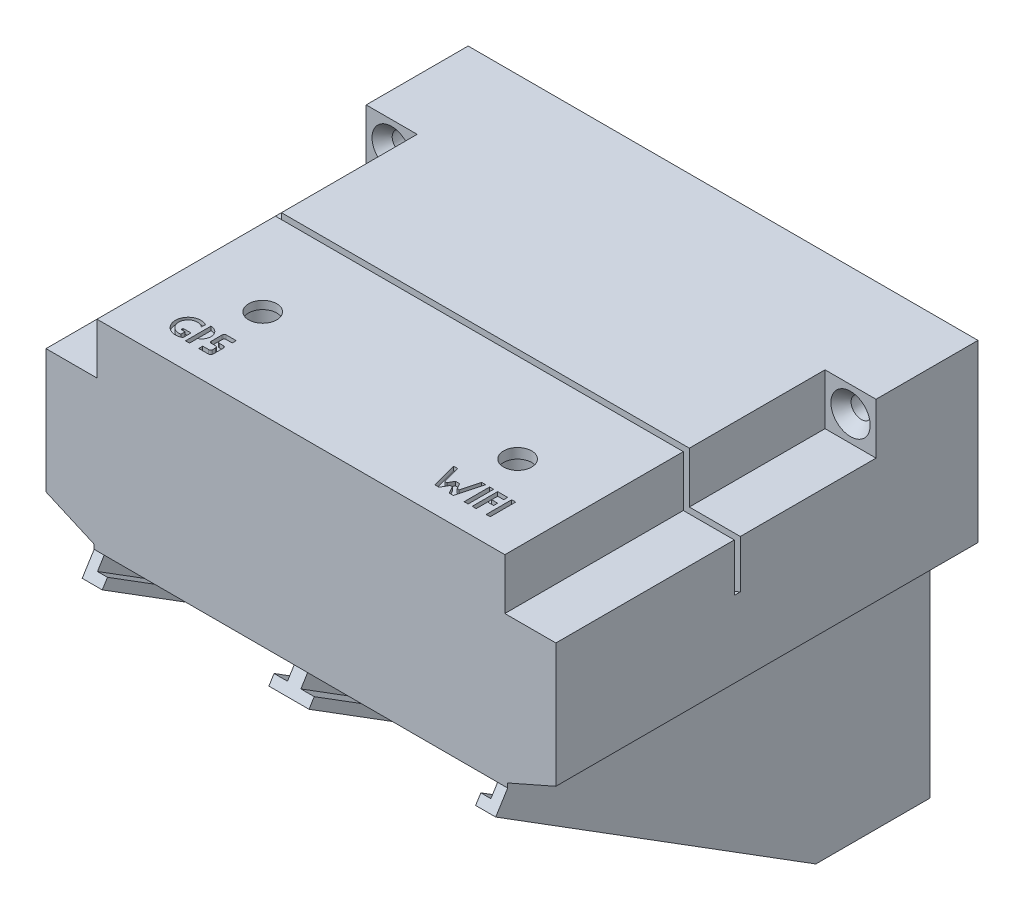
from build123d import *

# Parameters (mm, degrees)
BOSS_EXTRU_1_DEPTH                                = 59.2
BOSS_EXTRU_2_DEPTH                                = 1.5
BOSS_EXTRU_3_DEPTH                                = 44.45
ESQUISSE5_W                                       = 98
ESQUISSE5_H                                       = 50
ENL_V_MAT_EXTRU_1_DEPTH                           = 79.75
NERVURE3_REACH                                    = 219.919
ESQUISSE7_WALL_W                                  = 531.966109146
ESQUISSE7_WALL_H                                  = 10
ESQUISSE8_W                                       = 12.7
ESQUISSE8_H                                       = 12.7
ENL_V_MAT_EXTRU_2_DEPTH                           = 79.75
FRAISAGE_POUR_VIS_T_TE_FRAIS_E_BOMB_E_D           = 5.1054
FRAISAGE_POUR_VIS_T_TE_FRAIS_E_BOMB_E_CSINK_D     = 9.779
FRAISAGE_POUR_VIS_T_TE_FRAIS_E_BOMB_E_CSINK_ANGLE = 82
ENL_VEMENT_START                                  = 1.582341914
ENL_VEMENT_DE_MATI_RE_BALAYAGE2_OUTLINE_R         = 6.35
ENL_VEMENT_DE_MATI_RE_BALAYAGE2_DEPTH             = 71.529963189
ENL_VEMENT_START_2                                = -14.345570266
ENL_VEMENT_DE_MATI_RE_BALAYAGE3_OUTLINE_R         = 6.35
ENL_VEMENT_DE_MATI_RE_BALAYAGE3_DEPTH             = 71.529963189
ESQUISSE26_R                                      = 6.35
ENL_V_MAT_EXTRU_4_DEPTH                           = 3.175
ENL_V_MAT_EXTRU_5_REACH                           = 258.559
ESQUISSE27_R                                      = 3.5
ESQUISSE35_W                                      = 1
ESQUISSE35_H                                      = 6.35
LETTRE_I_WIFI_2_DEPTH                             = 1
LETTRE_F_DEPTH                                    = 1
ESQUISSE38_W                                      = 1
ESQUISSE38_H                                      = 6.35
LETTRE_I_WIFI_1_DEPTH                             = 1
LETTRE_W_DEPTH                                    = 1
LETTRE_G_DEPTH                                    = 1
LETTRE_P_DEPTH                                    = 1
LETTRE_S_DEPTH                                    = 1
ESQUISSE28_R                                      = 5.55625
TROU_FIL_GPS_DEPTH                                = 48
ESQUISSE28_4_R                                    = 5.55625
TROU_FIL_WIFI_DEPTH                               = 47.5
NERVURE9_REACH                                    = 258.559
ESQUISSE44_WALL_W                                 = 609.246066174
ESQUISSE44_WALL_H                                 = 2.5
BOSS_EXTRU_4_REACH                                = 258.559
BOSS_EXTRU_5_DEPTH                                = 2.5
BOSS_EXTRU_8_REACH                                = 249.303
ESQUISSE51_W                                      = 2.5
ESQUISSE51_H                                      = 105.15
BOSS_EXTRU_7_DEPTH                                = 94.127905
ESQUISSE52_W                                      = 2.5
ESQUISSE52_H                                      = 2.446117838
BOSS_EXTRU_9_DEPTH                                = 94.127905
ENL_V_MAT_EXTRU_7_REACH                           = 263.075
ENL_V_MAT_EXTRU_8_REACH                           = 258.559


# Read off the part's stored shape, not the designer's step: Enlèvement de matière-Balayage2, Enlèvement de matière-Balayage3
with BuildPart() as part:
    # Esquisse2 → Boss.-Extru.1 (new body)
    with BuildSketch(Plane.XY):
        Polygon((0, 0), (98, 0), (98, 50), (211.579865137, 100), (-113.579865137, 100), (0, 50), align=None)
    extrude(amount=BOSS_EXTRU_1_DEPTH)

    # Esquisse3 → Boss.-Extru.2 (add)
    with BuildSketch(Plane.XY.offset(59.2)):
        Polygon((0, 0), (98, 0), (98, 50), (211.579865137, 100), (168.51775825, 100), (92.873568069, 66.7), (5.126431931, 66.7), (-70.51775825, 100), (-113.579865137, 100), (0, 50), align=None)
    extrude(amount=BOSS_EXTRU_2_DEPTH)

    # Esquisse4 → Boss.-Extru.3 (add)
    with BuildSketch(Plane.XY.offset(60.7)):
        Polygon((0, 0), (98, 0), (98, 50), (211.579865137, 100), (-113.579865137, 100), (0, 50), align=None)
    extrude(amount=BOSS_EXTRU_3_DEPTH)

    # Esquisse5 → Enlèv. mat.-Extru.1 (cut)
    with BuildSketch(Plane.XY.offset(105.15)):
        with Locations((49, 25)):
            Rectangle(ESQUISSE5_W, ESQUISSE5_H)
    extrude(amount=-ENL_V_MAT_EXTRU_1_DEPTH, mode=Mode.SUBTRACT)

    # Esquisse7 wall → Nervure3 (add, up to next)
    with BuildSketch(Plane(origin=(49, 25, 65.275), x_dir=(0, -0.531192105031, -0.847251407525), z_dir=(0, 0.847251407525, -0.531192105031)), mode=Mode.PRIVATE) as nervure3_sk1:
        Rectangle(ESQUISSE7_WALL_W, ESQUISSE7_WALL_H)
    nervure3_tool1 = extrude(nervure3_sk1.sketch, amount=NERVURE3_REACH, mode=Mode.PRIVATE) - part.part
    add(nervure3_tool1.solids().sort_by_distance((49, 25, 65.275))[0])

    # Esquisse8 → Enlèv. mat.-Extru.2 (cut)
    with BuildSketch(Plane.XY.offset(105.15)):
        with Locations((-8.15, 93.65)):
            Rectangle(ESQUISSE8_W, ESQUISSE8_H)
    enl_v_mat_extru_2 = extrude(amount=-ENL_V_MAT_EXTRU_2_DEPTH, mode=Mode.SUBTRACT)

    # Symétrie1: Enlèv. mat.-Extru.2 across plane
    add(enl_v_mat_extru_2.mirror(Plane(origin=(49, 0, 0), x_dir=(0, 0, 1), z_dir=(1, 0, 0))), mode=Mode.SUBTRACT)

    # Fraisage pour vis à tête fraisée bombée #101 (through all)
    with Locations(Plane.XY.offset(25.4)):
        with Locations((22, 25), (76, 25), (106.15, 93.65), (-8.15, 93.65)):
            CounterSinkHole(FRAISAGE_POUR_VIS_T_TE_FRAIS_E_BOMB_E_D / 2, FRAISAGE_POUR_VIS_T_TE_FRAIS_E_BOMB_E_CSINK_D / 2, counter_sink_angle=FRAISAGE_POUR_VIS_T_TE_FRAIS_E_BOMB_E_CSINK_ANGLE)

    # Enlèvement de matière-Balayage2 outline → Enlèvement de matière-Balayage2 (cut)
    with BuildSketch(Plane(origin=(0, 0, 0), x_dir=(0.8002544678430299, -0.3970882953901229, 0.44934805258444765), z_dir=(0.5996605595645498, 0.5299192642332058, -0.5996605595645498)).offset(ENL_VEMENT_START)):
        with Locations((6.44062437, -61.833135415)):
            Circle(ENL_VEMENT_DE_MATI_RE_BALAYAGE2_OUTLINE_R)
    extrude(amount=ENL_VEMENT_DE_MATI_RE_BALAYAGE2_DEPTH, mode=Mode.SUBTRACT)

    # Enlèvement de matière-Balayage3 outline → Enlèvement de matière-Balayage3 (cut)
    with BuildSketch(Plane(origin=(0, 0, 0), x_dir=(0.8002544678430281, 0.39708829539012125, -0.4493480525844523), z_dir=(0.5996605595645522, -0.5299192642332002, 0.5996605595645522)).offset(ENL_VEMENT_START_2)):
        with Locations((71.984313478, 61.833135415)):
            Circle(ENL_VEMENT_DE_MATI_RE_BALAYAGE3_OUTLINE_R)
    extrude(amount=ENL_VEMENT_DE_MATI_RE_BALAYAGE3_DEPTH, mode=Mode.SUBTRACT)

    # Esquisse26 → Enlèv. mat.-Extru.4 (cut)
    with BuildSketch(Plane(origin=(0, 0, 0), x_dir=(-1, 0, 0), z_dir=(0, 0, -1))):
        with Locations((-49, 82.52)):
            Circle(ESQUISSE26_R)
    extrude(amount=-ENL_V_MAT_EXTRU_4_DEPTH, mode=Mode.SUBTRACT)

    # Esquisse27 → Enlèv. mat.-Extru.5 (cut, up to next)
    with BuildSketch(Plane(origin=(0, 100, 0), x_dir=(1, 0, 0), z_dir=(0, 1, 0)), mode=Mode.PRIVATE) as enl_v_mat_extru_5_sk1:
        with Locations(Location((17.25, -82.925, 0), (0, 0, 180))):
            Circle(ESQUISSE27_R)
    enl_v_mat_extru_5_tool1 = extrude(enl_v_mat_extru_5_sk1.sketch, amount=-ENL_V_MAT_EXTRU_5_REACH, mode=Mode.PRIVATE) & part.part
    # Esquisse27 → Enlèv. mat.-Extru.5 (cut, up to next)
    with BuildSketch(Plane(origin=(0, 100, 0), x_dir=(1, 0, 0), z_dir=(0, 1, 0)), mode=Mode.PRIVATE) as enl_v_mat_extru_5_sk2:
        with Locations(Location((80.75, -82.925, 0), (0, 0, 180))):
            Circle(ESQUISSE27_R)
    enl_v_mat_extru_5_tool2 = extrude(enl_v_mat_extru_5_sk2.sketch, amount=-ENL_V_MAT_EXTRU_5_REACH, mode=Mode.PRIVATE) & part.part
    add(enl_v_mat_extru_5_tool1.solids().sort_by_distance((17.25, 100, 82.925))[0], mode=Mode.SUBTRACT)
    add(enl_v_mat_extru_5_tool2.solids().sort_by_distance((80.75, 100, 82.925))[0], mode=Mode.SUBTRACT)

    # Esquisse35 → Lettre_i(wifi)_2 (cut)
    with BuildSketch(Plane(origin=(0, 100, 0), x_dir=(1, 0, 0), z_dir=(0, 1, 0))):
        with Locations((89.3, -95.625)):
            Rectangle(ESQUISSE35_W, ESQUISSE35_H)
    extrude(amount=-LETTRE_I_WIFI_2_DEPTH, mode=Mode.SUBTRACT)

    # Esquisse36 → Lettre_F (cut)
    with BuildSketch(Plane(origin=(0, 100, 0), x_dir=(1, 0, 0), z_dir=(0, 1, 0))):
        Polygon((85.3, -98.8), (86.3, -98.8), (86.3, -95.95), (87.8, -95.95), (87.8, -94.95), (86.3, -94.95), (86.3, -93.45), (87.8, -93.45), (87.8, -92.45), (85.3, -92.45), align=None)
    extrude(amount=-LETTRE_F_DEPTH, mode=Mode.SUBTRACT)

    # Esquisse38 → Lettre_i(wifi)_1 (cut)
    with BuildSketch(Plane(origin=(0, 100, 0), x_dir=(1, 0, 0), z_dir=(0, 1, 0))):
        with Locations((83.8, -95.625)):
            Rectangle(ESQUISSE38_W, ESQUISSE38_H)
    extrude(amount=-LETTRE_I_WIFI_1_DEPTH, mode=Mode.SUBTRACT)

    # Esquisse39 → Lettre_W (cut)
    with BuildSketch(Plane(origin=(0, 100, 0), x_dir=(1, 0, 0), z_dir=(0, 1, 0))):
        Polygon((74.3625, -92.45), (76.063977372, -98.8), (77.063977372, -98.8), (78.08125, -97.038032123), (78.58125, -97.038032123), (79.598522628, -98.8), (80.598522628, -98.8), (82.3, -92.45), (81.3, -92.45), (80.123041681, -96.842468245), (79.623041681, -96.842468245), (78.83125, -95.471044825), (77.83125, -95.471044825), (77.039458319, -96.842468245), (76.539458319, -96.842468245), (75.3625, -92.45), align=None)
    extrude(amount=-LETTRE_W_DEPTH, mode=Mode.SUBTRACT)

    # Esquisse40 → Lettre_G (cut)
    with BuildSketch(Plane(origin=(0, 100, 0), x_dir=(1, 0, 0), z_dir=(0, 1, 0))):
        with BuildLine():
            Line((11.894022551, -97.913045102), (11.894022551, -96.913045102))
            Line((11.894022551, -96.913045102), (10.894022551, -96.913045102))
            Line((10.894022551, -96.913045102), (10.894022551, -96.413045102))
            Line((10.894022551, -96.413045102), (12.894022551, -96.413045102))
            Line((12.894022551, -96.413045102), (12.894022551, -98.413045102))
            ThreePointArc((12.894022551, -98.413045102), (8.2, -95.625), (12.894022551, -92.836954898))
            Line((12.894022551, -92.836954898), (12.894022551, -93.836954898))
            ThreePointArc((12.894022551, -93.836954898), (9.096396306, -95.065983006), (11.894022551, -97.913045102))
        make_face()
    extrude(amount=-LETTRE_G_DEPTH, mode=Mode.SUBTRACT)

    # Esquisse41 → Lettre_P (cut)
    with BuildSketch(Plane(origin=(0, 100, 0), x_dir=(1, 0, 0), z_dir=(0, 1, 0))):
        with BuildLine():
            Line((14.894022551, -98.8), (13.894022551, -98.8))
            Line((13.894022551, -98.8), (13.894022551, -92.45))
            ThreePointArc((13.894022551, -92.45), (16.125753942, -94.22690083), (14.894022551, -96.8))
            Line((14.894022551, -96.8), (14.894022551, -98.8))
        make_face()
    extrude(amount=-LETTRE_P_DEPTH, mode=Mode.SUBTRACT)

    # Esquisse42 → Lettre_S (cut)
    with BuildSketch(Plane(origin=(0, 100, 0), x_dir=(1, 0, 0), z_dir=(0, 1, 0))):
        with BuildLine():
            Line((20.18396508, -93.45), (18.68396508, -93.45))
            ThreePointArc((18.68396508, -93.45), (18.330411689, -93.596446609), (18.18396508, -93.95))
            Line((18.18396508, -93.95), (18.18396508, -94.625))
            ThreePointArc((18.18396508, -94.625), (18.330411689, -94.978553391), (18.68396508, -95.125))
            Line((18.68396508, -95.125), (19.68396508, -95.125))
            ThreePointArc((19.68396508, -95.125), (20.03751847, -95.271446609), (20.18396508, -95.625))
            Line((20.18396508, -95.625), (20.18396508, -98.3))
            ThreePointArc((20.18396508, -98.3), (20.03751847, -98.653553391), (19.68396508, -98.8))
            Line((19.68396508, -98.8), (17.18396508, -98.8))
            Line((17.18396508, -98.8), (17.18396508, -97.8))
            Line((17.18396508, -97.8), (18.68396508, -97.8))
            ThreePointArc((18.68396508, -97.8), (19.03751847, -97.653553391), (19.18396508, -97.3))
            Line((19.18396508, -97.3), (19.18396508, -96.625))
            ThreePointArc((19.18396508, -96.625), (19.03751847, -96.271446609), (18.68396508, -96.125))
            Line((18.68396508, -96.125), (17.68396508, -96.125))
            ThreePointArc((17.68396508, -96.125), (17.330411689, -95.978553391), (17.18396508, -95.625))
            Line((17.18396508, -95.625), (17.18396508, -92.95))
            ThreePointArc((17.18396508, -92.95), (17.330411689, -92.596446609), (17.68396508, -92.45))
            Line((17.68396508, -92.45), (20.18396508, -92.45))
            Line((20.18396508, -92.45), (20.18396508, -93.45))
        make_face()
    extrude(amount=-LETTRE_S_DEPTH, mode=Mode.SUBTRACT)

    # Esquisse28 → trou_fil_gps (cut)
    with BuildSketch(Plane.XZ.offset(-50)):
        with Locations(Location((17.25, 82.925, 0), (0, 0, 270))):
            Circle(ESQUISSE28_R)
    extrude(amount=-TROU_FIL_GPS_DEPTH, mode=Mode.SUBTRACT)

    # Esquisse28<4> → trou_fil_wifi (cut)
    with BuildSketch(Plane.XZ.offset(-50)):
        with Locations(Location((80.75, 82.925, 0), (0, 0, 270))):
            Circle(ESQUISSE28_4_R)
    extrude(amount=-TROU_FIL_WIFI_DEPTH, mode=Mode.SUBTRACT)

    # Esquisse44 wall → Nervure9 (add, up to next)
    with BuildSketch(Plane(origin=(0, 25, 65.275), x_dir=(0, 0.531192105031, 0.847251407525), z_dir=(0, 0.847251407525, -0.531192105031)), mode=Mode.PRIVATE) as nervure9_sk1:
        with Locations((0, 1.25)):
            Rectangle(ESQUISSE44_WALL_W, ESQUISSE44_WALL_H)
    nervure9_tool1 = extrude(nervure9_sk1.sketch, amount=NERVURE9_REACH, mode=Mode.PRIVATE) - part.part
    nervure9 = nervure9_tool1.solids().sort_by_distance((0, 25, 65.275))[0]
    add(nervure9)

    # Symétrie2: Nervure9 across plane
    add(nervure9.mirror(Plane.ZY.offset(-49)))

    # Boss.-Extru.4: up to this face of the body (flat: up to its plane)
    boss_extru_4_end = Plane(part.part.faces().sort_by_distance((98, 30.090642155, 36.697287119))[0])
    # Esquisse46 → Boss.-Extru.4 (add, up to the picked face)
    with BuildSketch(Plane.ZY, mode=Mode.PRIVATE) as boss_extru_4_sk1:
        Polygon((25.4, 0), (28.385893417, -4.7625), (0, -4.7625), (0, 0), align=None)
    boss_extru_4_tool1 = split(extrude(boss_extru_4_sk1.sketch, amount=-BOSS_EXTRU_4_REACH, mode=Mode.PRIVATE), bisect_by=boss_extru_4_end, keep=Keep.BOTH, mode=Mode.PRIVATE)
    add(boss_extru_4_tool1.solids().sort_by(Axis((0, -2.425315, 13.460287), (1, 0, 0)))[0])

    # Esquisse47 → Boss.-Extru.5 (add)
    with BuildSketch(Plane(origin=(98, 0, 0), x_dir=(0, 0, -1), z_dir=(1, 0, 0))):
        Polygon((-115.732080917, 50), (0, 50), (0, -4.7625), (-28.385893417, -4.7625), align=None)
    boss_extru_5 = extrude(amount=BOSS_EXTRU_5_DEPTH)

    # Esquisse51 → Boss.-Extru.8 (add, up to next)
    with BuildSketch(Plane(origin=(0, 50, 0), x_dir=(1, 0, 0), z_dir=(0, 1, 0)), mode=Mode.PRIVATE) as boss_extru_8_sk1:
        with Locations((99.25, -52.575)):
            Rectangle(ESQUISSE51_W, ESQUISSE51_H)
    boss_extru_8_tool1 = extrude(boss_extru_8_sk1.sketch, amount=BOSS_EXTRU_8_REACH, mode=Mode.PRIVATE) - part.part
    boss_extru_8 = boss_extru_8_tool1.solids().sort_by_distance((99.25, 50, 52.575))[0]
    add(boss_extru_8)

    # Esquisse49 → Boss.-Extru.7 (add)
    with BuildSketch(Plane(origin=(0, 11.43135277, 18.233007668), x_dir=(1, 0, 0), z_dir=(0, 0.5311921050311517, 0.8472514075246932))):
        Polygon((50.67, -13.492279468), (50.67, -16.667279468), (54, -16.667279468), (54, -19.113397306), (44, -19.113397306), (44, -16.667279468), (47.33, -16.667279468), (47.33, -13.492279468), align=None)
    extrude(amount=BOSS_EXTRU_7_DEPTH)

    # Esquisse52 → Boss.-Extru.9 (add)
    with BuildSketch(Plane(origin=(0, 11.43135277, 18.233007668), x_dir=(1, 0, 0), z_dir=(0, 0.5311921050311517, 0.8472514075246932))):
        with Locations((96.75, -17.890338387)):
            Rectangle(ESQUISSE52_W, ESQUISSE52_H)
    boss_extru_9 = extrude(amount=BOSS_EXTRU_9_DEPTH)

    # Esquisse54 → Enlèv. mat.-Extru.7 (cut, up to next)
    with BuildSketch(Plane.ZY.offset(-98), mode=Mode.PRIVATE) as enl_v_mat_extru_7_sk1:
        Polygon((108.135893417, 45.2375), (105.15, 50), (115.732080917, 50), align=None)
    enl_v_mat_extru_7_tool1 = extrude(enl_v_mat_extru_7_sk1.sketch, amount=-ENL_V_MAT_EXTRU_7_REACH, mode=Mode.PRIVATE) & part.part
    enl_v_mat_extru_7 = enl_v_mat_extru_7_tool1.solids().sort_by_distance((98, 48.4125, 109.672658))[0]
    add(enl_v_mat_extru_7, mode=Mode.SUBTRACT)

    # Symétrie6: Boss.-Extru.5, Boss.-Extru.8, Boss.-Extru.9, Enlèv. mat.-Extru.7 across plane
    add(boss_extru_5.mirror(Plane.ZY.offset(-49)))
    add(boss_extru_8.mirror(Plane.ZY.offset(-49)))
    add(boss_extru_9.mirror(Plane.ZY.offset(-49)))
    add(enl_v_mat_extru_7.mirror(Plane.ZY.offset(-49)), mode=Mode.SUBTRACT)

    # Esquisse55 → Enlèv. mat.-Extru.8 (cut, up to next)
    with BuildSketch(Plane.XY.offset(105.15), mode=Mode.PRIVATE) as enl_v_mat_extru_8_sk1:
        Polygon((-14.5, 100), (-14.5, 56.38317363), (-113.579865137, 100), align=None)
    enl_v_mat_extru_8_tool1 = extrude(enl_v_mat_extru_8_sk1.sketch, amount=-ENL_V_MAT_EXTRU_8_REACH, mode=Mode.PRIVATE) & part.part
    # Esquisse55 → Enlèv. mat.-Extru.8 (cut, up to next)
    with BuildSketch(Plane.XY.offset(105.15), mode=Mode.PRIVATE) as enl_v_mat_extru_8_sk2:
        Polygon((112.5, 100), (112.5, 56.38317363), (211.579865137, 100), align=None)
    enl_v_mat_extru_8_tool2 = extrude(enl_v_mat_extru_8_sk2.sketch, amount=-ENL_V_MAT_EXTRU_8_REACH, mode=Mode.PRIVATE) & part.part
    add(enl_v_mat_extru_8_tool1.solids().sort_by_distance((-47.526622, 85.461058, 105.15))[0], mode=Mode.SUBTRACT)
    add(enl_v_mat_extru_8_tool2.solids().sort_by_distance((145.526622, 85.461058, 105.15))[0], mode=Mode.SUBTRACT)


solid = part.part
